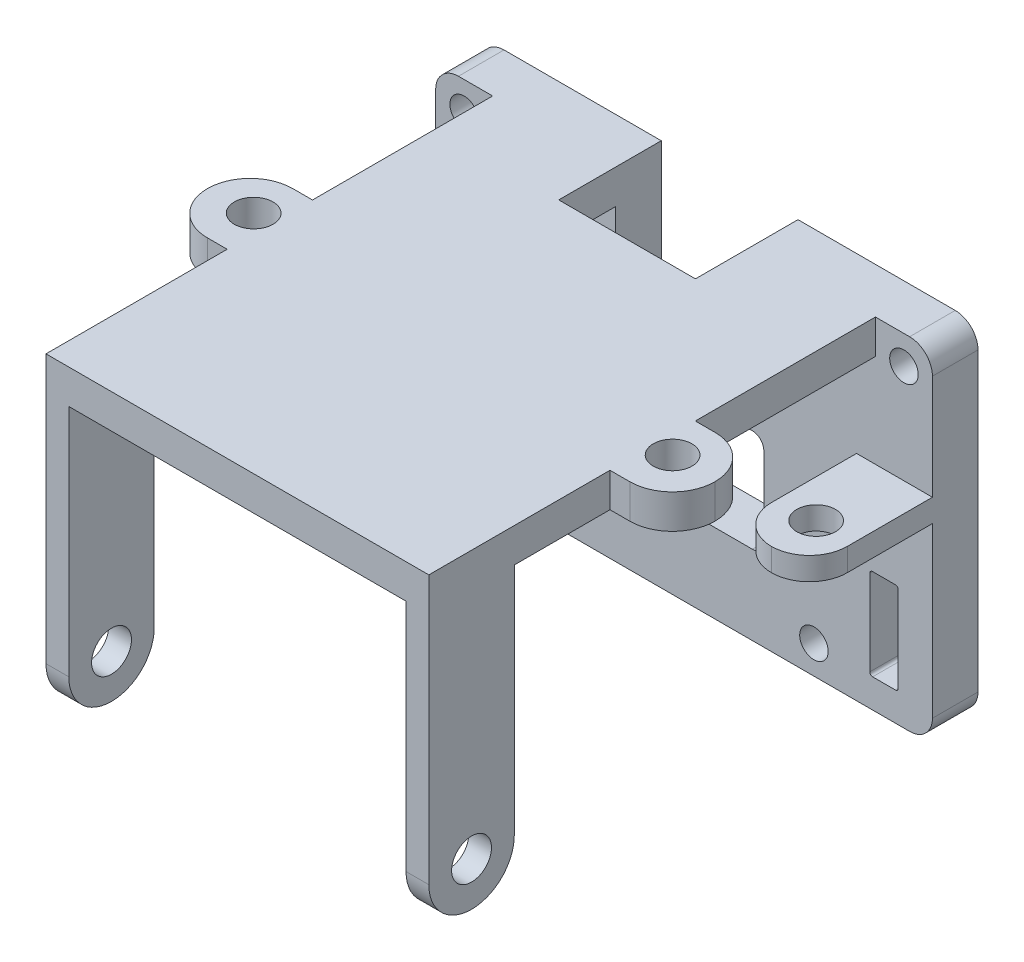
from build123d import *

# Parameters (mm, degrees)
SKETCH1_W                = 33.6
SKETCH1_H                = 30
BOSS_EXTRUDE1_DEPTH      = 4
SKETCH3_W                = 33.6
SKETCH3_H                = 3
BOSS_EXTRUDE2_DEPTH      = 39.2
SKETCH5_W                = 14
SKETCH5_H                = 9
CUT_EXTRUDE2_DEPTH       = 30
SKETCH8_W                = 12
SKETCH8_H                = 7
CUT_EXTRUDE4_DEPTH       = 46.20929108
SKETCH10_W               = 2
SKETCH10_H               = 7.5
BOSS_EXTRUDE3_DEPTH      = 24.3
SKETCH12_W               = 4
SKETCH12_H               = 30
BOSS_EXTRUDE4_DEPTH      = 5
SKETCH13_W               = 2.5
SKETCH13_H               = 8
CUT_EXTRUDE5_DEPTH       = 48.295665763
FILLET3_R                = 0.25
FILLET4_R                = 1
CUT_EXTRUDE6_REACH       = 58.747
SKETCH15_R               = 1.75
FILLET6_R                = 3.75
CUT_EXTRUDE8_REACH       = 49.296
SKETCH23_R               = 1.25
FILLET8_R                = 2
CUT_EXTRUDE9_REACH       = 58.934
SKETCH24_W               = 12
SKETCH24_H               = 18
ESBO_O1_W                = 7.49
ESBO_O1_H                = 3
RESSALTO_EXTRUS_O1_DEPTH = 5.475
FILETE1_R                = 3.7338
FILETE2_R                = 3.7338
ESBO_O2_R                = 1.7
CORTE_EXTRUS_O1_DEPTH    = 5
ESBO_O3_W                = 6.66
ESBO_O3_H                = 2
RESSALTO_EXTRUS_O2_DEPTH = 10.8
CORTE_EXTRUS_O2_REACH    = 54.114
ESBO_O5_R                = 1.7
FILETE3_R                = 3.33
FILETE4_R                = 3.33
FILLET3_OF_ESPELHAR5_R   = 0.25
FILLET6_OF_ESPELHAR5_R   = 3.75
FILLET8_OF_ESPELHAR5_R   = 2
FILETE1_OF_ESPELHAR5_R   = 3.7338
FILETE2_OF_ESPELHAR5_R   = 3.7338
FILETE3_OF_ESPELHAR5_R   = 3.33
FILETE4_OF_ESPELHAR5_R   = 3.33


with BuildPart() as part:
    # Sketch1 → Boss-Extrude1 (new body)
    with BuildSketch(Plane.XY):
        Rectangle(SKETCH1_W, SKETCH1_H)
    extrude(amount=BOSS_EXTRUDE1_DEPTH)

    # Sketch3 → Boss-Extrude2 (add)
    with BuildSketch(Plane.XY.offset(4)):
        with Locations((0, 13.5)):
            Rectangle(SKETCH3_W, SKETCH3_H)
    extrude(amount=BOSS_EXTRUDE2_DEPTH)

    # Sketch5 → Cut-Extrude2 (cut)
    with BuildSketch(Plane.XY.offset(4)):
        with Locations((0, -3.55)):
            Rectangle(SKETCH5_W, SKETCH5_H)
    extrude(amount=-CUT_EXTRUDE2_DEPTH, mode=Mode.SUBTRACT)

    # Sketch8 → Cut-Extrude4 (cut, through all)
    with BuildSketch(Plane.XY.offset(4)):
        with Locations((0, 8.5)):
            Rectangle(SKETCH8_W, SKETCH8_H)
    extrude(amount=-CUT_EXTRUDE4_DEPTH, mode=Mode.SUBTRACT)

    # Sketch10 → Boss-Extrude3 (add)
    with BuildSketch(Plane.XZ.offset(-12)):
        with Locations((15.8, 39.45)):
            Rectangle(SKETCH10_W, SKETCH10_H)
    boss_extrude3 = extrude(amount=BOSS_EXTRUDE3_DEPTH)

    # Sketch12 → Boss-Extrude4 (add)
    with BuildSketch(Plane(origin=(16.8, 0, 0), x_dir=(0, 0, -1), z_dir=(1, 0, 0))):
        with Locations((-2, 0)):
            Rectangle(SKETCH12_W, SKETCH12_H)
    boss_extrude4 = extrude(amount=BOSS_EXTRUDE4_DEPTH)

    # Sketch13 → Cut-Extrude5 (cut, through all)
    with BuildSketch(Plane.XY.offset(4)):
        with Locations((17.55, -8.475)):
            Rectangle(SKETCH13_W, SKETCH13_H)
    cut_extrude5 = extrude(amount=-CUT_EXTRUDE5_DEPTH, mode=Mode.SUBTRACT)

    # Fillet3
    fillet3_edges = [part.edges().sort_by_distance(p)[0] for p in [
        (18.8, -4.475, 2),
        (18.8, -12.475, 2),
        (16.3, -12.475, 2),
        (16.3, -4.475, 2),
    ]]
    fillet(fillet3_edges, radius=FILLET3_R)

    # Fillet4
    fillet4_edges = [part.edges().sort_by_distance(p)[0] for p in [
        (7, 0.95, 2),
        (7, -8.05, 2),
        (-7, -8.05, 2),
        (-7, 0.95, 2),
        (6, 5, 2),
        (-6, 5, 2),
    ]]
    fillet(fillet4_edges, radius=FILLET4_R)

    # Sketch15 → Cut-Extrude6 (cut, up to next)
    with BuildSketch(Plane(origin=(16.8, 0, 0), x_dir=(0, 0, -1), z_dir=(1, 0, 0)), mode=Mode.PRIVATE) as cut_extrude6_sk1:
        with Locations((-39.45, -8.475)):
            Circle(SKETCH15_R)
    cut_extrude6_tool1 = extrude(cut_extrude6_sk1.sketch, amount=-CUT_EXTRUDE6_REACH, mode=Mode.PRIVATE) & part.part
    cut_extrude6 = cut_extrude6_tool1.solids().sort_by_distance((16.8, -8.475, 39.45))[0]
    add(cut_extrude6, mode=Mode.SUBTRACT)

    # Fillet6
    fillet6_edges = [part.edges().sort_by_distance(p)[0] for p in [
        (15.8, -12.3, 35.7),
        (15.8, -12.3, 43.2),
    ]]
    fillet(fillet6_edges, radius=FILLET6_R - 0.0001)  # a hair under: the kernel refuses the full size

    # Sketch23 → Cut-Extrude8 (cut, up to next)
    with BuildSketch(Plane.XY.offset(4), mode=Mode.PRIVATE) as cut_extrude8_sk1:
        with Locations((11.4, -12.5)):
            Circle(SKETCH23_R)
    cut_extrude8_tool1 = extrude(cut_extrude8_sk1.sketch, amount=-CUT_EXTRUDE8_REACH, mode=Mode.PRIVATE) & part.part
    # Sketch23 → Cut-Extrude8 (cut, up to next)
    with BuildSketch(Plane.XY.offset(4), mode=Mode.PRIVATE) as cut_extrude8_sk2:
        with Locations((19.3, 12.5)):
            Circle(SKETCH23_R)
    cut_extrude8_tool2 = extrude(cut_extrude8_sk2.sketch, amount=-CUT_EXTRUDE8_REACH, mode=Mode.PRIVATE) & part.part
    cut_extrude8_1 = cut_extrude8_tool1.solids().sort_by_distance((11.4, -12.5, 4))[0]
    add(cut_extrude8_1, mode=Mode.SUBTRACT)
    cut_extrude8_2 = cut_extrude8_tool2.solids().sort_by_distance((19.3, 12.5, 4))[0]
    add(cut_extrude8_2, mode=Mode.SUBTRACT)
    cut_extrude8 = cut_extrude8_1 + cut_extrude8_2  # Cut-Extrude8 as one shape, for the pattern or mirror that repeats it

    # Fillet8
    fillet8_edges = [part.edges().sort_by_distance(p)[0] for p in [
        (21.8, 15, 2),
        (21.8, -15, 2),
    ]]
    fillet(fillet8_edges, radius=FILLET8_R)

    # Sketch24 → Cut-Extrude9 (cut, up to next)
    with BuildSketch(Plane(origin=(0, 15, 0), x_dir=(1, 0, 0), z_dir=(0, 1, 0)), mode=Mode.PRIVATE) as cut_extrude9_sk1:
        Rectangle(SKETCH24_W, SKETCH24_H)
    cut_extrude9_tool1 = extrude(cut_extrude9_sk1.sketch, amount=-CUT_EXTRUDE9_REACH, mode=Mode.PRIVATE) & part.part
    add(cut_extrude9_tool1.solids().sort_by_distance((0, 15, 0))[0], mode=Mode.SUBTRACT)

    # Esboço1 → Ressalto-extrusão1 (add)
    with BuildSketch(Plane(origin=(16.8, 0, 0), x_dir=(0, 0, -1), z_dir=(1, 0, 0))):
        with Locations((-23.555, 13.5)):
            Rectangle(ESBO_O1_W, ESBO_O1_H)
    ressalto_extrus_o1 = extrude(amount=RESSALTO_EXTRUS_O1_DEPTH)

    # Filete1
    filete1_edges = [part.edges().sort_by_distance(p)[0] for p in [
        (22.275, 13.5, 27.3),
    ]]
    fillet(filete1_edges, radius=FILETE1_R)

    # Filete2
    filete2_edges = [part.edges().sort_by_distance(p)[0] for p in [
        (22.275, 13.5, 19.81),
    ]]
    fillet(filete2_edges, radius=FILETE2_R)

    # Esboço2 → Corte-extrusão1 (cut)
    with BuildSketch(Plane(origin=(0, 15, 0), x_dir=(1, 0, 0), z_dir=(0, 1, 0))):
        with Locations(Location((18.385, -23.39, 0), (0, 0, 270))):
            Circle(ESBO_O2_R)
    corte_extrus_o1 = extrude(amount=-CORTE_EXTRUS_O1_DEPTH, mode=Mode.SUBTRACT)

    # Esboço3 → Ressalto-extrusão2 (add)
    with BuildSketch(Plane.XY.offset(4)):
        with Locations((18.47, 2.8)):
            Rectangle(ESBO_O3_W, ESBO_O3_H)
    ressalto_extrus_o2 = extrude(amount=RESSALTO_EXTRUS_O2_DEPTH)

    # Esboço5 → Corte-extrusão2 (cut, up to next)
    with BuildSketch(Plane(origin=(0, 3.8, 0), x_dir=(1, 0, 0), z_dir=(0, 1, 0)), mode=Mode.PRIVATE) as corte_extrus_o2_sk1:
        with Locations(Location((18.47, -10.875, 0), (0, 0, 180))):
            Circle(ESBO_O5_R)
    corte_extrus_o2_tool1 = extrude(corte_extrus_o2_sk1.sketch, amount=-CORTE_EXTRUS_O2_REACH, mode=Mode.PRIVATE) & part.part
    corte_extrus_o2 = corte_extrus_o2_tool1.solids().sort_by_distance((18.47, 3.8, 10.875))[0]
    add(corte_extrus_o2, mode=Mode.SUBTRACT)

    # Filete3
    filete3_edges = [part.edges().sort_by_distance(p)[0] for p in [
        (21.8, 2.8, 14.8),
    ]]
    fillet(filete3_edges, radius=FILETE3_R)

    # Filete4
    filete4_edges = [part.edges().sort_by_distance(p)[0] for p in [
        (15.14, 2.8, 14.8),
    ]]
    fillet(filete4_edges, radius=FILETE4_R - 0.0001)  # a hair under: the kernel refuses the full size

    # Espelhar5: Boss-Extrude3, Boss-Extrude4, Cut-Extrude5, Cut-Extrude6, Cut-Extrude8, Ressalto-extrusão1, Corte-extrusão1, Ressalto-extrusão2, Corte-extrusão2 across plane
    add(boss_extrude3.mirror(Plane.ZY))
    add(boss_extrude4.mirror(Plane.ZY))
    add(cut_extrude5.mirror(Plane.ZY), mode=Mode.SUBTRACT)
    add(cut_extrude6.mirror(Plane.ZY), mode=Mode.SUBTRACT)
    add(cut_extrude8.mirror(Plane.ZY), mode=Mode.SUBTRACT)
    add(ressalto_extrus_o1.mirror(Plane.ZY))
    add(corte_extrus_o1.mirror(Plane.ZY), mode=Mode.SUBTRACT)
    add(ressalto_extrus_o2.mirror(Plane.ZY))
    add(corte_extrus_o2.mirror(Plane.ZY), mode=Mode.SUBTRACT)

    # Fillet3 of Espelhar5
    fillet3_of_espelhar5_edges = [part.edges().sort_by_distance(p)[0] for p in [
        (-18.8, -4.475, 2),
        (-18.8, -12.475, 2),
        (-16.3, -12.475, 2),
        (-16.3, -4.475, 2),
    ]]
    fillet(fillet3_of_espelhar5_edges, radius=FILLET3_OF_ESPELHAR5_R)

    # Fillet6 of Espelhar5
    fillet6_of_espelhar5_edges = [part.edges().sort_by_distance(p)[0] for p in [
        (-15.8, -12.3, 35.7),
        (-15.8, -12.3, 43.2),
    ]]
    fillet(fillet6_of_espelhar5_edges, radius=FILLET6_OF_ESPELHAR5_R - 0.0001)  # a hair under: the kernel refuses the full size

    # Fillet8 of Espelhar5
    fillet8_of_espelhar5_edges = [part.edges().sort_by_distance(p)[0] for p in [
        (-21.8, 15, 2),
        (-21.8, -15, 2),
    ]]
    fillet(fillet8_of_espelhar5_edges, radius=FILLET8_OF_ESPELHAR5_R)

    # Filete1 of Espelhar5
    filete1_of_espelhar5_edges = [part.edges().sort_by_distance(p)[0] for p in [
        (-22.275, 13.5, 27.3),
    ]]
    fillet(filete1_of_espelhar5_edges, radius=FILETE1_OF_ESPELHAR5_R)

    # Filete2 of Espelhar5
    filete2_of_espelhar5_edges = [part.edges().sort_by_distance(p)[0] for p in [
        (-22.275, 13.5, 19.81),
    ]]
    fillet(filete2_of_espelhar5_edges, radius=FILETE2_OF_ESPELHAR5_R)

    # Filete3 of Espelhar5
    filete3_of_espelhar5_edges = [part.edges().sort_by_distance(p)[0] for p in [
        (-21.8, 2.8, 14.8),
    ]]
    fillet(filete3_of_espelhar5_edges, radius=FILETE3_OF_ESPELHAR5_R)

    # Filete4 of Espelhar5
    filete4_of_espelhar5_edges = [part.edges().sort_by_distance(p)[0] for p in [
        (-15.14, 2.8, 14.8),
    ]]
    fillet(filete4_of_espelhar5_edges, radius=FILETE4_OF_ESPELHAR5_R - 0.0001)  # a hair under: the kernel refuses the full size


solid = part.part
